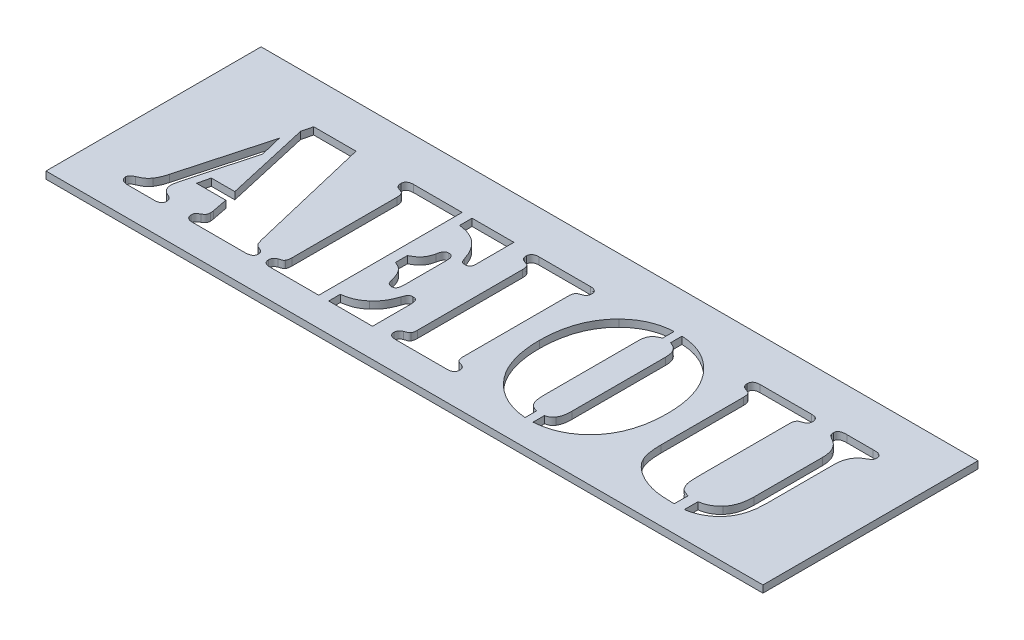
from build123d import *

# Parameters (mm, degrees)
SKETCH1_W           = 50
SKETCH1_H           = 15
BOSS_EXTRUDE1_DEPTH = 0.5
CUT_EXTRUDE1_REACH  = 28.106


with BuildPart() as part:
    # Sketch1 → Boss-Extrude1 (new body)
    with BuildSketch(Plane(origin=(0, 0, 0), x_dir=(1, 0, 0), z_dir=(0, 1, 0))):
        Rectangle(SKETCH1_W, SKETCH1_H)
    extrude(amount=BOSS_EXTRUDE1_DEPTH)

    # Sketch2 → Cut-Extrude1 (cut, up to next)
    with BuildSketch(Plane(origin=(0, 0.5, 0), x_dir=(1, 0, 0), z_dir=(0, 1, 0)), mode=Mode.PRIVATE) as cut_extrude1_sk1:
        with BuildLine():
            Line((-18.337673611, 4.507033689), (-15.386284722, 4.507033689))
            Line((-15.386284722, 4.507033689), (-13.335503472, -4.101907283))
            add(Edge.make_bspline(
                [(-13.335503472, -4.101907283), (-13.31571659, -4.173193323), (-13.277982556, -4.309137424), (-13.227253077, -4.440773778), (-13.203125, -4.503382978)],
                knots=[0, 0, 0, 0, 1.048755183, 2, 2, 2, 2], degree=3))
            add(Edge.make_bspline(
                [(-13.203125, -4.503382978), (-13.189801958, -4.526708407), (-13.162169427, -4.575086298), (-13.09409429, -4.634093988), (-13.009454398, -4.688410957), (-12.943250713, -4.716359995), (-12.907986111, -4.731247561)],
                knots=[0, 0, 0, 0, 0.840160251, 1.742526606, 2.797515595, 4, 4, 4, 4], degree=3))
            add(Edge.make_bspline(
                [(-12.907986111, -4.731247561), (-12.852666047, -4.75584302), (-12.757778354, -4.79803036), (-12.641851728, -4.881220271), (-12.575758787, -4.989270356), (-12.571630909, -5.068863034), (-12.569444444, -5.111021867)],
                knots=[0, 0, 0, 0, 1.326867952, 2.275909135, 3.086779591, 4, 4, 4, 4], degree=3))
            add(Edge.make_bspline(
                [(-12.569444444, -5.111021867), (-12.570763223, -5.140939839), (-12.573307323, -5.198655589), (-12.602706683, -5.278735913), (-12.650267163, -5.347111766), (-12.717303399, -5.401839339), (-12.802967775, -5.442991364), (-12.905532483, -5.472848329), (-13.026827736, -5.489279696), (-13.113376601, -5.491680641), (-13.159722222, -5.492966311)],
                knots=[0, 0, 0, 0, 0.899652897, 1.735550104, 2.535289427, 3.388132219, 4.315971308, 5.386976564, 6.600765056, 8, 8, 8, 8], degree=3))
            Line((-13.159722222, -5.492966311), (-16.814236111, -5.492966311))
            add(Edge.make_bspline(
                [(-16.814236111, -5.492966311), (-16.848382867, -5.492037961), (-16.914538807, -5.490239376), (-17.00724797, -5.467551949), (-17.09105245, -5.435117567), (-17.162233739, -5.387795061), (-17.219559933, -5.328245792), (-17.262338966, -5.259855291), (-17.286573738, -5.181299037), (-17.289931903, -5.126374168), (-17.291666667, -5.098001033)],
                knots=[0, 0, 0, 0, 1.175318829, 2.277063206, 3.273429624, 4.263211015, 5.198644873, 6.106027898, 7.021610334, 8, 8, 8, 8], degree=3))
            add(Edge.make_bspline(
                [(-17.291666667, -5.098001033), (-17.290296603, -5.054174847), (-17.287858408, -4.976180792), (-17.249915704, -4.884635257), (-17.198259915, -4.82860937), (-17.141642569, -4.786075371), (-17.071172085, -4.735594692), (-17.01571023, -4.704618629), (-16.985677083, -4.687844783)],
                knots=[0, 0, 0, 0, 1.432553572, 2.549404146, 3.155101411, 3.915709373, 4.871335893, 6, 6, 6, 6], degree=3))
            add(Edge.make_bspline(
                [(-16.985677083, -4.687844783), (-16.9451778, -4.662997846), (-16.87225783, -4.618260316), (-16.78822521, -4.527889373), (-16.740696936, -4.419393316), (-16.737706092, -4.341127905), (-16.736111111, -4.299389922)],
                knots=[0, 0, 0, 0, 1.161992046, 2.092195629, 2.982591342, 4, 4, 4, 4], degree=3))
            add(Edge.make_bspline(
                [(-16.736111111, -4.299389922), (-16.736415512, -4.259500284), (-16.736988204, -4.184452867), (-16.749691292, -4.110507236), (-16.755642361, -4.075865617)],
                knots=[0, 0, 0, 0, 1.063051602, 2, 2, 2, 2], degree=3))
            Line((-16.755642361, -4.075865617), (-16.968315972, -2.992966311))
            Line((-16.968315972, -2.992966311), (-19.010416667, -2.992966311))
            Line((-19.010416667, -2.992966311), (-18.812934028, -2.159632978))
            Line((-18.812934028, -2.159632978), (-17.172309028, -2.159632978))
            Line((-17.172309028, -2.159632978), (-18.519965278, 3.777867022))
            Line((-18.519965278, 3.777867022), (-18.337673611, 4.507033689))
        make_face()
    cut_extrude1_tool1 = extrude(cut_extrude1_sk1.sketch, amount=-CUT_EXTRUDE1_REACH, mode=Mode.PRIVATE) & part.part
    # Sketch2 → Cut-Extrude1 (cut, up to next)
    with BuildSketch(Plane(origin=(0, 0.5, 0), x_dir=(1, 0, 0), z_dir=(0, 1, 0)), mode=Mode.PRIVATE) as cut_extrude1_sk2:
        with BuildLine():
            Line((-18.843315972, 2.619012856), (-18.470052083, 1.095575356))
            Line((-18.470052083, 1.095575356), (-19.735243056, -3.613626033))
            add(Edge.make_bspline(
                [(-19.735243056, -3.613626033), (-19.75113154, -3.678415772), (-19.781579767, -3.802576928), (-19.78840363, -3.930202275), (-19.791666667, -3.9912302)],
                knots=[0, 0, 0, 0, 1.043639418, 2, 2, 2, 2], degree=3))
            add(Edge.make_bspline(
                [(-19.791666667, -3.9912302), (-19.787963166, -4.062970612), (-19.780891211, -4.19996126), (-19.702393275, -4.386972131), (-19.578817938, -4.544382617), (-19.46462721, -4.611690815), (-19.405381944, -4.646612144)],
                knots=[0, 0, 0, 0, 1.065909191, 2.035388236, 2.980705811, 4, 4, 4, 4], degree=3))
            Line((-19.405381944, -4.646612144), (-19.175347222, -4.763799644))
            add(Edge.make_bspline(
                [(-19.175347222, -4.763799644), (-19.142106966, -4.783717378), (-19.078737399, -4.82168875), (-19.00680033, -4.907779295), (-18.964568383, -5.012653825), (-18.960459118, -5.088926146), (-18.958333333, -5.128382978)],
                knots=[0, 0, 0, 0, 1.03129857, 1.96607825, 2.947821365, 4, 4, 4, 4], degree=3))
            add(Edge.make_bspline(
                [(-18.958333333, -5.128382978), (-18.959020346, -5.156816813), (-18.960335004, -5.211227419), (-18.985850009, -5.286539465), (-19.023169141, -5.351042161), (-19.074519983, -5.406256547), (-19.144270206, -5.443927793), (-19.226280524, -5.472489442), (-19.322985388, -5.489340254), (-19.392295496, -5.491705239), (-19.429253472, -5.492966311)],
                knots=[0, 0, 0, 0, 1.001089615, 1.915671698, 2.776004461, 3.626767041, 4.544209435, 5.547912865, 6.692482548, 8, 8, 8, 8], degree=3))
            Line((-19.429253472, -5.492966311), (-21.2890625, -5.492966311))
            add(Edge.make_bspline(
                [(-21.2890625, -5.492966311), (-21.331854338, -5.492048359), (-21.413714078, -5.49029234), (-21.529085555, -5.468108104), (-21.63155355, -5.433861621), (-21.718141382, -5.38471791), (-21.788376453, -5.322204498), (-21.839322542, -5.248007396), (-21.868381196, -5.161482218), (-21.872739289, -5.101107781), (-21.875, -5.069789228)],
                knots=[0, 0, 0, 0, 1.263225168, 2.41651886, 3.457937625, 4.444571192, 5.337806274, 6.215550556, 7.074337118, 8, 8, 8, 8], degree=3))
            add(Edge.make_bspline(
                [(-21.875, -5.069789228), (-21.871241677, -5.034860509), (-21.863453385, -4.962478467), (-21.794191419, -4.865733653), (-21.689498084, -4.781855681), (-21.602045649, -4.740843279), (-21.553819444, -4.718226728)],
                knots=[0, 0, 0, 0, 0.824400861, 1.708388363, 2.736276122, 4, 4, 4, 4], degree=3))
            add(Edge.make_bspline(
                [(-21.553819444, -4.718226728), (-21.506631177, -4.697629331), (-21.4179337, -4.658913412), (-21.296373128, -4.599119387), (-21.196233501, -4.540066501), (-21.084561047, -4.466021097), (-20.960504741, -4.354339601), (-20.878678201, -4.248760553), (-20.835503472, -4.193053117)],
                knots=[0, 0, 0, 0, 1.026075952, 1.928664772, 2.697596979, 3.341335493, 4.597189607, 6, 6, 6, 6], degree=3))
            add(Edge.make_bspline(
                [(-20.835503472, -4.193053117), (-20.801818581, -4.139426182), (-20.731441334, -4.027384375), (-20.644343492, -3.838823248), (-20.562546251, -3.627682914), (-20.520894771, -3.475912121), (-20.499131944, -3.396612144)],
                knots=[0, 0, 0, 0, 0.874304226, 1.826668352, 2.864437965, 4, 4, 4, 4], degree=3))
            Line((-20.499131944, -3.396612144), (-18.843315972, 2.619012856))
        make_face()
    cut_extrude1_tool2 = extrude(cut_extrude1_sk2.sketch, amount=-CUT_EXTRUDE1_REACH, mode=Mode.PRIVATE) & part.part
    # Sketch2 → Cut-Extrude1 (cut, up to next)
    with BuildSketch(Plane(origin=(0, 0.5, 0), x_dir=(1, 0, 0), z_dir=(0, 1, 0)), mode=Mode.PRIVATE) as cut_extrude1_sk3:
        with BuildLine():
            Line((-7.986111111, 4.507033689), (-7.986111111, -5.492966311))
            Line((-7.986111111, -5.492966311), (-11.187065972, -5.492966311))
            Line((-11.187065972, -5.492966311), (-11.378038194, -5.492966311))
            add(Edge.make_bspline(
                [(-11.378038194, -5.492966311), (-11.415734546, -5.491718984), (-11.486509234, -5.489377135), (-11.586733015, -5.472032688), (-11.674261968, -5.442864847), (-11.747034819, -5.39861559), (-11.806665932, -5.343796693), (-11.844521933, -5.274744009), (-11.87067092, -5.197499905), (-11.873501501, -5.142374945), (-11.875, -5.113192006)],
                knots=[0, 0, 0, 0, 1.275809178, 2.395324508, 3.433364274, 4.378530456, 5.262016052, 6.140052186, 7.015350866, 8, 8, 8, 8], degree=3))
            add(Edge.make_bspline(
                [(-11.875, -5.113192006), (-11.872047558, -5.067075163), (-11.866494123, -4.980331052), (-11.814398118, -4.861973807), (-11.723355218, -4.771569958), (-11.645072128, -4.7380814), (-11.603732639, -4.720396867)],
                knots=[0, 0, 0, 0, 1.074896783, 2.021841926, 2.955380476, 4, 4, 4, 4], degree=3))
            add(Edge.make_bspline(
                [(-11.603732639, -4.720396867), (-11.569685212, -4.708241351), (-11.510203504, -4.687005361), (-11.433201524, -4.657612075), (-11.379181117, -4.638852896), (-11.33541294, -4.62199473), (-11.295582717, -4.590150305), (-11.274903721, -4.557098147), (-11.263020833, -4.5381052)],
                knots=[0, 0, 0, 0, 1.641128884, 2.867093284, 3.73955991, 4.239698614, 4.988468111, 6, 6, 6, 6], degree=3))
            add(Edge.make_bspline(
                [(-11.263020833, -4.5381052), (-11.249721562, -4.516134601), (-11.221073296, -4.468807227), (-11.197388785, -4.382380337), (-11.181799641, -4.280462451), (-11.180992777, -4.206882707), (-11.180555556, -4.16701145)],
                knots=[0, 0, 0, 0, 0.795728394, 1.714096871, 2.761318972, 4, 4, 4, 4], degree=3))
            Line((-11.180555556, -4.16701145), (-11.180555556, 3.155037161))
            add(Edge.make_bspline(
                [(-11.180555556, 3.155037161), (-11.181085636, 3.195612043), (-11.182074586, 3.271310878), (-11.196757568, 3.37560309), (-11.221597027, 3.463786992), (-11.249769855, 3.512091591), (-11.263020833, 3.534811467)],
                knots=[0, 0, 0, 0, 1.234380862, 2.302932019, 3.201790819, 4, 4, 4, 4], degree=3))
            add(Edge.make_bspline(
                [(-11.263020833, 3.534811467), (-11.27491005, 3.553787726), (-11.295600059, 3.586810843), (-11.335370591, 3.618812666), (-11.379555471, 3.635299177), (-11.432563262, 3.657444964), (-11.510360933, 3.685467304), (-11.569742521, 3.70696688), (-11.603732639, 3.719273272)],
                knots=[0, 0, 0, 0, 1.009569614, 1.75688657, 2.256055053, 3.138468602, 4.362054748, 6, 6, 6, 6], degree=3))
            add(Edge.make_bspline(
                [(-11.603732639, 3.719273272), (-11.645307941, 3.736725906), (-11.725002164, 3.770180241), (-11.813794063, 3.865445165), (-11.866611021, 3.985651947), (-11.872088746, 4.073865817), (-11.875, 4.120748967)],
                knots=[0, 0, 0, 0, 1.03007389, 1.974512116, 2.923511095, 4, 4, 4, 4], degree=3))
            add(Edge.make_bspline(
                [(-11.875, 4.120748967), (-11.873466435, 4.150633704), (-11.87056708, 4.207133722), (-11.845038305, 4.286097394), (-11.806604348, 4.355639572), (-11.74710385, 4.410669351), (-11.673812929, 4.454249548), (-11.587250182, 4.486806964), (-11.486427418, 4.503220442), (-11.415706114, 4.505708492), (-11.378038194, 4.507033689)],
                knots=[0, 0, 0, 0, 1.002003185, 1.894384998, 2.766311233, 3.643649008, 4.582238159, 5.621343591, 6.733068665, 8, 8, 8, 8], degree=3))
            Line((-11.378038194, 4.507033689), (-11.187065972, 4.507033689))
            Line((-11.187065972, 4.507033689), (-7.986111111, 4.507033689))
        make_face()
    cut_extrude1_tool3 = extrude(cut_extrude1_sk3.sketch, amount=-CUT_EXTRUDE1_REACH, mode=Mode.PRIVATE) & part.part
    # Sketch2 → Cut-Extrude1 (cut, up to next)
    with BuildSketch(Plane(origin=(0, 0.5, 0), x_dir=(1, 0, 0), z_dir=(0, 1, 0)), mode=Mode.PRIVATE) as cut_extrude1_sk4:
        with BuildLine():
            Line((-7.291666667, 4.507033689), (-4.375, 4.507033689))
            Line((-4.375, 4.507033689), (-4.375, 1.874655217))
            add(Edge.make_bspline(
                [(-4.375, 1.874655217), (-4.375142515, 1.83979283), (-4.375406039, 1.775328797), (-4.394584754, 1.686721636), (-4.418381545, 1.610801577), (-4.458588591, 1.550396857), (-4.510969484, 1.50434005), (-4.576059238, 1.474974141), (-4.652224237, 1.4540813), (-4.707580347, 1.452389752), (-4.737413194, 1.451478133)],
                knots=[0, 0, 0, 0, 1.297100046, 2.398467488, 3.37194797, 4.248080405, 5.071011418, 5.940462097, 6.890061477, 8, 8, 8, 8], degree=3))
            add(Edge.make_bspline(
                [(-4.737413194, 1.451478133), (-4.783166633, 1.454292744), (-4.864361998, 1.459287633), (-4.961916961, 1.499883234), (-5.007499181, 1.563147057), (-5.043170528, 1.622892329), (-5.076658193, 1.700436418), (-5.095977961, 1.758752155), (-5.106336806, 1.7900198)],
                knots=[0, 0, 0, 0, 1.496408907, 2.655570162, 3.259085196, 3.998612629, 4.926899124, 6, 6, 6, 6], degree=3))
            add(Edge.make_bspline(
                [(-5.106336806, 1.7900198), (-5.154432703, 1.925909722), (-5.246724198, 2.186669677), (-5.432796711, 2.543225001), (-5.65238284, 2.848016138), (-5.906870473, 3.103657718), (-6.196968911, 3.310815802), (-6.527236633, 3.467510134), (-6.894786798, 3.582305839), (-7.156334657, 3.618223312), (-7.291666667, 3.636807994)],
                knots=[0, 0, 0, 0, 1.130832012, 2.169960077, 3.145894403, 4.069657363, 4.990096479, 5.930045021, 6.928948727, 8, 8, 8, 8], degree=3))
            Line((-7.291666667, 3.636807994), (-7.291666667, 4.507033689))
        make_face()
    cut_extrude1_tool4 = extrude(cut_extrude1_sk4.sketch, amount=-CUT_EXTRUDE1_REACH, mode=Mode.PRIVATE) & part.part
    # Sketch2 → Cut-Extrude1 (cut, up to next)
    with BuildSketch(Plane(origin=(0, 0.5, 0), x_dir=(1, 0, 0), z_dir=(0, 1, 0)), mode=Mode.PRIVATE) as cut_extrude1_sk5:
        with BuildLine():
            Line((-7.291666667, -0.851039228), (-7.291666667, -0.0068552))
            add(Edge.make_bspline(
                [(-7.291666667, -0.0068552), (-7.227635008, 0.027877684), (-7.105237776, 0.09426998), (-6.93635889, 0.200205559), (-6.798654485, 0.317803711), (-6.6809029, 0.438287035), (-6.588038715, 0.577000689), (-6.507511755, 0.730780446), (-6.442633332, 0.906126489), (-6.411537258, 1.030848356), (-6.395399306, 1.095575356)],
                knots=[0, 0, 0, 0, 1.180986571, 2.257469038, 3.222785507, 4.110265038, 4.978639913, 5.917385587, 6.919184056, 8, 8, 8, 8], degree=3))
            add(Edge.make_bspline(
                [(-6.395399306, 1.095575356), (-6.386107869, 1.139198457), (-6.369042952, 1.219317889), (-6.333625507, 1.327400225), (-6.296665359, 1.414657552), (-6.25135665, 1.482349561), (-6.197411524, 1.531479427), (-6.135554325, 1.567477738), (-6.063077838, 1.587136658), (-6.012124521, 1.589251365), (-5.985243056, 1.590367022)],
                knots=[0, 0, 0, 0, 1.505392146, 2.764846178, 3.836585285, 4.697326174, 5.492824879, 6.280783141, 7.092991927, 8, 8, 8, 8], degree=3))
            add(Edge.make_bspline(
                [(-5.985243056, 1.590367022), (-5.950095918, 1.588982531), (-5.883295321, 1.58635117), (-5.793223499, 1.547505383), (-5.720724744, 1.485314004), (-5.690630735, 1.430298507), (-5.674913194, 1.401564939)],
                knots=[0, 0, 0, 0, 1.085852217, 2.06376913, 2.988742716, 4, 4, 4, 4], degree=3))
            add(Edge.make_bspline(
                [(-5.674913194, 1.401564939), (-5.666934147, 1.380052299), (-5.647713417, 1.328230494), (-5.636692181, 1.23100867), (-5.624172412, 1.10460153), (-5.624704157, 1.009562515), (-5.625, 0.956686467)],
                knots=[0, 0, 0, 0, 0.609895254, 1.469176849, 2.591947466, 4, 4, 4, 4], degree=3))
            Line((-5.625, 0.956686467), (-5.625, -1.818921172))
            add(Edge.make_bspline(
                [(-5.625, -1.818921172), (-5.625764447, -1.872464188), (-5.627172135, -1.971060691), (-5.638656283, -2.106505705), (-5.66162695, -2.215257957), (-5.693106585, -2.30113506), (-5.741154251, -2.36363081), (-5.803875932, -2.407240963), (-5.882023898, -2.433398926), (-5.9394547, -2.436016299), (-5.970052083, -2.437410756)],
                knots=[0, 0, 0, 0, 1.58411055, 2.917051989, 4.012593196, 4.866950163, 5.598911493, 6.305405458, 7.097171608, 8, 8, 8, 8], degree=3))
            add(Edge.make_bspline(
                [(-5.970052083, -2.437410756), (-6.019746209, -2.43310677), (-6.114599549, -2.424891564), (-6.217602219, -2.353995936), (-6.27336733, -2.271946988), (-6.311582169, -2.193368166), (-6.347006429, -2.098291899), (-6.364338969, -2.028206003), (-6.373697917, -1.990362144)],
                knots=[0, 0, 0, 0, 1.342036637, 2.56160375, 3.240040044, 4.033620071, 4.938225671, 6, 6, 6, 6], degree=3))
            add(Edge.make_bspline(
                [(-6.373697917, -1.990362144), (-6.393675917, -1.910256924), (-6.431844618, -1.757212968), (-6.513243125, -1.547151143), (-6.602507344, -1.363566939), (-6.710724579, -1.211479897), (-6.832272929, -1.085052144), (-6.968287431, -0.981000856), (-7.122866093, -0.901446968), (-7.234588839, -0.868083982), (-7.291666667, -0.851039228)],
                knots=[0, 0, 0, 0, 1.278531199, 2.442680666, 3.485773606, 4.434753066, 5.322955403, 6.195374153, 7.078038041, 8, 8, 8, 8], degree=3))
        make_face()
    cut_extrude1_tool5 = extrude(cut_extrude1_sk5.sketch, amount=-CUT_EXTRUDE1_REACH, mode=Mode.PRIVATE) & part.part
    # Sketch2 → Cut-Extrude1 (cut, up to next)
    with BuildSketch(Plane(origin=(0, 0.5, 0), x_dir=(1, 0, 0), z_dir=(0, 1, 0)), mode=Mode.PRIVATE) as cut_extrude1_sk6:
        with BuildLine():
            Line((-7.291666667, -5.492966311), (-7.291666667, -4.685674644))
            add(Edge.make_bspline(
                [(-7.291666667, -4.685674644), (-7.215597208, -4.672576709), (-7.069315869, -4.647389418), (-6.860813059, -4.60086497), (-6.673588692, -4.543465203), (-6.501404602, -4.481341049), (-6.342464288, -4.399566429), (-6.184288901, -4.305913852), (-6.027201681, -4.193554934), (-5.926082643, -4.108398961), (-5.874565972, -4.065014922)],
                knots=[0, 0, 0, 0, 1.178424117, 2.266106011, 3.258322885, 4.167001624, 5.056005255, 5.982165939, 6.971982955, 8, 8, 8, 8], degree=3))
            add(Edge.make_bspline(
                [(-5.874565972, -4.065014922), (-5.776817748, -3.973793712), (-5.590195801, -3.799633209), (-5.398821034, -3.544867268), (-5.272841712, -3.327661352), (-5.184249868, -3.14260185), (-5.095131538, -2.936068105), (-5.042528294, -2.787866818), (-5.015190972, -2.710848256)],
                knots=[0, 0, 0, 0, 1.478913818, 2.823557948, 3.509390326, 4.258413643, 5.094916917, 6, 6, 6, 6], degree=3))
            add(Edge.make_bspline(
                [(-5.015190972, -2.710848256), (-5.001897739, -2.673790969), (-4.977345045, -2.605345907), (-4.936980055, -2.512962537), (-4.893755081, -2.440827729), (-4.836190652, -2.368517059), (-4.737773384, -2.308471768), (-4.649373675, -2.301952042), (-4.602864583, -2.298521867)],
                knots=[0, 0, 0, 0, 1.119865357, 2.068399023, 2.86239926, 3.505232302, 4.687446157, 6, 6, 6, 6], degree=3))
            add(Edge.make_bspline(
                [(-4.602864583, -2.298521867), (-4.570959118, -2.30041317), (-4.511375565, -2.303945186), (-4.42827902, -2.323761959), (-4.362288052, -2.364835693), (-4.311228512, -2.42268634), (-4.277661776, -2.500918236), (-4.251664888, -2.597937028), (-4.237728146, -2.717702161), (-4.236677979, -2.80486029), (-4.236111111, -2.851907283)],
                knots=[0, 0, 0, 0, 0.999578033, 1.866714988, 2.638932701, 3.392362113, 4.242509345, 5.27434009, 6.528718957, 8, 8, 8, 8], degree=3))
            Line((-4.236111111, -2.851907283), (-4.236111111, -5.492966311))
            Line((-4.236111111, -5.492966311), (-7.291666667, -5.492966311))
        make_face()
    cut_extrude1_tool6 = extrude(cut_extrude1_sk6.sketch, amount=-CUT_EXTRUDE1_REACH, mode=Mode.PRIVATE) & part.part
    # Sketch2 → Cut-Extrude1 (cut, up to next)
    with BuildSketch(Plane(origin=(0, 0.5, 0), x_dir=(1, 0, 0), z_dir=(0, 1, 0)), mode=Mode.PRIVATE) as cut_extrude1_sk7:
        with BuildLine():
            Line((0.770399306, -5.492966311), (-2.437065972, -5.492966311))
            Line((-2.437065972, -5.492966311), (-2.628038194, -5.492966311))
            add(Edge.make_bspline(
                [(-2.628038194, -5.492966311), (-2.665734546, -5.491718984), (-2.736509234, -5.489377135), (-2.836733015, -5.472032688), (-2.924261968, -5.442864847), (-2.997034819, -5.39861559), (-3.056665932, -5.343796693), (-3.094521933, -5.274744009), (-3.12067092, -5.197499905), (-3.123501501, -5.142374945), (-3.125, -5.113192006)],
                knots=[0, 0, 0, 0, 1.275809178, 2.395324508, 3.433364274, 4.378530456, 5.262016052, 6.140052186, 7.015350866, 8, 8, 8, 8], degree=3))
            add(Edge.make_bspline(
                [(-3.125, -5.113192006), (-3.122047558, -5.067075163), (-3.116494123, -4.980331052), (-3.064398118, -4.861973807), (-2.973355218, -4.771569958), (-2.895072128, -4.7380814), (-2.853732639, -4.720396867)],
                knots=[0, 0, 0, 0, 1.074896783, 2.021841926, 2.955380476, 4, 4, 4, 4], degree=3))
            add(Edge.make_bspline(
                [(-2.853732639, -4.720396867), (-2.819685212, -4.708241351), (-2.760203504, -4.687005361), (-2.683201524, -4.657612075), (-2.629181117, -4.638852896), (-2.58541294, -4.62199473), (-2.545582717, -4.590150305), (-2.524903721, -4.557098147), (-2.513020833, -4.5381052)],
                knots=[0, 0, 0, 0, 1.641128884, 2.867093284, 3.73955991, 4.239698614, 4.988468111, 6, 6, 6, 6], degree=3))
            add(Edge.make_bspline(
                [(-2.513020833, -4.5381052), (-2.499721562, -4.516134601), (-2.471073296, -4.468807227), (-2.447388785, -4.382380337), (-2.431799641, -4.280462451), (-2.430992777, -4.206882707), (-2.430555556, -4.16701145)],
                knots=[0, 0, 0, 0, 0.795728394, 1.714096871, 2.761318972, 4, 4, 4, 4], degree=3))
            Line((-2.430555556, -4.16701145), (-2.430555556, 3.155037161))
            add(Edge.make_bspline(
                [(-2.430555556, 3.155037161), (-2.431085636, 3.195612043), (-2.432074586, 3.271310878), (-2.446757568, 3.37560309), (-2.471597027, 3.463786992), (-2.499769855, 3.512091591), (-2.513020833, 3.534811467)],
                knots=[0, 0, 0, 0, 1.234380862, 2.302932019, 3.201790819, 4, 4, 4, 4], degree=3))
            add(Edge.make_bspline(
                [(-2.513020833, 3.534811467), (-2.52491005, 3.553787726), (-2.545600059, 3.586810843), (-2.585370591, 3.618812666), (-2.629555471, 3.635299177), (-2.682563262, 3.657444964), (-2.760360933, 3.685467304), (-2.819742521, 3.70696688), (-2.853732639, 3.719273272)],
                knots=[0, 0, 0, 0, 1.009569614, 1.75688657, 2.256055053, 3.138468602, 4.362054748, 6, 6, 6, 6], degree=3))
            add(Edge.make_bspline(
                [(-2.853732639, 3.719273272), (-2.895307941, 3.736725906), (-2.975002164, 3.770180241), (-3.063794063, 3.865445165), (-3.116611021, 3.985651947), (-3.122088746, 4.073865817), (-3.125, 4.120748967)],
                knots=[0, 0, 0, 0, 1.03007389, 1.974512116, 2.923511095, 4, 4, 4, 4], degree=3))
            add(Edge.make_bspline(
                [(-3.125, 4.120748967), (-3.123466435, 4.150633704), (-3.12056708, 4.207133722), (-3.095038305, 4.286097394), (-3.056604348, 4.355639572), (-2.99710385, 4.410669351), (-2.923812929, 4.454249548), (-2.837250182, 4.486806964), (-2.736427418, 4.503220442), (-2.665706114, 4.505708492), (-2.628038194, 4.507033689)],
                knots=[0, 0, 0, 0, 1.002003185, 1.894384998, 2.766311233, 3.643649008, 4.582238159, 5.621343591, 6.733068665, 8, 8, 8, 8], degree=3))
            Line((-2.628038194, 4.507033689), (-2.437065972, 4.507033689))
            Line((-2.437065972, 4.507033689), (0.770399306, 4.507033689))
            Line((0.770399306, 4.507033689), (0.961371528, 4.507033689))
            add(Edge.make_bspline(
                [(0.961371528, 4.507033689), (0.99902501, 4.505672993), (1.06971921, 4.503118293), (1.170050395, 4.487254698), (1.255432353, 4.453668014), (1.328459968, 4.410823357), (1.387429437, 4.355004749), (1.428825272, 4.286797017), (1.453737105, 4.207034976), (1.456743272, 4.150599543), (1.458333333, 4.120748967)],
                knots=[0, 0, 0, 0, 1.268560657, 2.381715452, 3.39938894, 4.339185152, 5.217651218, 6.10317875, 6.996708201, 8, 8, 8, 8], degree=3))
            add(Edge.make_bspline(
                [(1.458333333, 4.120748967), (1.455422079, 4.073865817), (1.449944354, 3.985651947), (1.397127397, 3.865445165), (1.308335498, 3.770180241), (1.228641275, 3.736725906), (1.187065972, 3.719273272)],
                knots=[0, 0, 0, 0, 1.076488905, 2.025487884, 2.96992611, 4, 4, 4, 4], degree=3))
            add(Edge.make_bspline(
                [(1.187065972, 3.719273272), (1.153059126, 3.707016915), (1.093648312, 3.685604751), (1.015380162, 3.656865066), (0.961389584, 3.635553293), (0.916872884, 3.619239442), (0.879006507, 3.585857494), (0.858381309, 3.553613728), (0.846354167, 3.534811467)],
                knots=[0, 0, 0, 0, 1.636602956, 2.859186374, 3.771360974, 4.270120389, 4.991257728, 6, 6, 6, 6], degree=3))
            add(Edge.make_bspline(
                [(0.846354167, 3.534811467), (0.832873596, 3.512154179), (0.804317845, 3.464159485), (0.783681901, 3.374940476), (0.76427582, 3.271638055), (0.764023783, 3.195687136), (0.763888889, 3.155037161)],
                knots=[0, 0, 0, 0, 0.798774196, 1.692034923, 2.764745377, 4, 4, 4, 4], degree=3))
            Line((0.763888889, 3.155037161), (0.763888889, -4.16701145))
            add(Edge.make_bspline(
                [(0.763888889, -4.16701145), (0.763925248, -4.206960488), (0.763992452, -4.28080057), (0.784300197, -4.381715539), (0.80380566, -4.4691761), (0.832830063, -4.516195986), (0.846354167, -4.5381052)],
                knots=[0, 0, 0, 0, 1.239531227, 2.291096129, 3.203725438, 4, 4, 4, 4], degree=3))
            add(Edge.make_bspline(
                [(0.846354167, -4.5381052), (0.858375481, -4.556923467), (0.878990683, -4.58919468), (0.916910432, -4.622430069), (0.961030017, -4.639104185), (1.015986245, -4.65705328), (1.093501913, -4.687129197), (1.153005832, -4.708286431), (1.187065972, -4.720396867)],
                knots=[0, 0, 0, 0, 1.010634903, 1.733125261, 2.232820463, 3.135449138, 4.360326402, 6, 6, 6, 6], degree=3))
            add(Edge.make_bspline(
                [(1.187065972, -4.720396867), (1.228405461, -4.7380814), (1.306688551, -4.771569958), (1.397731452, -4.861973807), (1.449827456, -4.980331052), (1.455380892, -5.067075163), (1.458333333, -5.113192006)],
                knots=[0, 0, 0, 0, 1.044619524, 1.978158074, 2.925103217, 4, 4, 4, 4], degree=3))
            add(Edge.make_bspline(
                [(1.458333333, -5.113192006), (1.45678028, -5.142342004), (1.453846647, -5.197404741), (1.428288993, -5.275432372), (1.387490285, -5.343162373), (1.328388782, -5.39876629), (1.255895927, -5.442290542), (1.169516431, -5.472470036), (1.069805026, -5.489280045), (0.999054833, -5.491685243), (0.961371528, -5.492966311)],
                knots=[0, 0, 0, 0, 0.985947552, 1.862400454, 2.754162249, 3.638812863, 4.585225398, 5.601516872, 6.722508463, 8, 8, 8, 8], degree=3))
            Line((0.961371528, -5.492966311), (0.770399306, -5.492966311))
        make_face()
    cut_extrude1_tool7 = extrude(cut_extrude1_sk7.sketch, amount=-CUT_EXTRUDE1_REACH, mode=Mode.PRIVATE) & part.part
    # Sketch2 → Cut-Extrude1 (cut, up to next)
    with BuildSketch(Plane(origin=(0, 0.5, 0), x_dir=(1, 0, 0), z_dir=(0, 1, 0)), mode=Mode.PRIVATE) as cut_extrude1_sk8:
        with BuildLine():
            add(Edge.make_bspline(
                [(6.597222222, 3.905905217), (6.537967892, 3.882791211), (6.425837781, 3.839051353), (6.275413432, 3.753624415), (6.152548713, 3.656030221), (6.053519568, 3.544410772), (5.985481519, 3.408710809), (5.935601491, 3.251481711), (5.909252157, 3.066186614), (5.905029636, 2.934478257), (5.902777778, 2.86423855)],
                knots=[0, 0, 0, 0, 1.118377415, 2.116364868, 3.030964595, 3.870538326, 4.719041391, 5.681309848, 6.763448884, 8, 8, 8, 8], degree=3))
            Line((5.902777778, 2.86423855), (5.902777778, -3.670049644))
            add(Edge.make_bspline(
                [(5.902777778, -3.670049644), (5.904128244, -3.769350753), (5.906622472, -3.952753709), (5.942204985, -4.20399337), (5.991756127, -4.41230182), (6.054639288, -4.524551828), (6.082899306, -4.574997561)],
                knots=[0, 0, 0, 0, 1.27427824, 2.353512468, 3.260059993, 4, 4, 4, 4], degree=3))
            add(Edge.make_bspline(
                [(6.082899306, -4.574997561), (6.109679505, -4.609669956), (6.165945458, -4.682517631), (6.284716053, -4.768326802), (6.430915076, -4.837678285), (6.539515281, -4.870210763), (6.597222222, -4.887497561)],
                knots=[0, 0, 0, 0, 0.851726799, 1.789501929, 2.825406619, 4, 4, 4, 4], degree=3))
            Line((6.597222222, -4.887497561), (6.597222222, -5.688278811))
            add(Edge.make_bspline(
                [(6.597222222, -5.688278811), (6.463794356, -5.674648809), (6.200313105, -5.647733518), (5.815584739, -5.568261499), (5.447107845, -5.460355318), (5.096342049, -5.319868406), (4.760540671, -5.153338218), (4.442700684, -4.954430224), (4.140660498, -4.726093511), (3.9560796, -4.552169852), (3.862847222, -4.464320478)],
                knots=[0, 0, 0, 0, 1.051385509, 2.076180753, 3.076110661, 4.059092477, 5.035964268, 6.012044883, 6.995877765, 8, 8, 8, 8], degree=3))
            add(Edge.make_bspline(
                [(3.862847222, -4.464320478), (3.747746555, -4.342428363), (3.518281865, -4.099424243), (3.226312282, -3.688257115), (2.980683394, -3.24276188), (2.777842708, -2.762907031), (2.622119463, -2.246855526), (2.510318279, -1.697006699), (2.441597866, -1.111752557), (2.434303745, -0.710173952), (2.430555556, -0.503817006)],
                knots=[0, 0, 0, 0, 0.929101366, 1.852256478, 2.788058139, 3.746505495, 4.736611211, 5.773063896, 6.855656831, 8, 8, 8, 8], degree=3))
            add(Edge.make_bspline(
                [(2.430555556, -0.503817006), (2.434881391, -0.295983082), (2.443348957, 0.110839524), (2.517098555, 0.70462232), (2.632848285, 1.267976644), (2.797497847, 1.79903176), (3.009535067, 2.295873918), (3.270672192, 2.75347614), (3.569891943, 3.178727082), (3.810177465, 3.424932957), (3.930121528, 3.5478323)],
                knots=[0, 0, 0, 0, 1.123125173, 2.198451065, 3.229210727, 4.228575418, 5.199030772, 6.142910105, 7.072990733, 8, 8, 8, 8], degree=3))
            add(Edge.make_bspline(
                [(3.930121528, 3.5478323), (4.024866737, 3.635619454), (4.211349561, 3.808407043), (4.512125249, 4.034501006), (4.823979769, 4.226705588), (5.148047336, 4.386488137), (5.485592463, 4.515607742), (5.840555395, 4.610751473), (6.212394476, 4.677014013), (6.467477853, 4.695243944), (6.597222222, 4.704516328)],
                knots=[0, 0, 0, 0, 1.041191674, 2.049331728, 3.02892685, 3.991699427, 4.959285675, 5.938654922, 6.951527461, 8, 8, 8, 8], degree=3))
            Line((6.597222222, 4.704516328), (6.597222222, 3.905905217))
        make_face()
    cut_extrude1_tool8 = extrude(cut_extrude1_sk8.sketch, amount=-CUT_EXTRUDE1_REACH, mode=Mode.PRIVATE) & part.part
    # Sketch2 → Cut-Extrude1 (cut, up to next)
    with BuildSketch(Plane(origin=(0, 0.5, 0), x_dir=(1, 0, 0), z_dir=(0, 1, 0)), mode=Mode.PRIVATE) as cut_extrude1_sk9:
        with BuildLine():
            Line((7.152777778, 3.905905217), (7.152777778, 4.704516328))
            add(Edge.make_bspline(
                [(7.152777778, 4.704516328), (7.282537425, 4.69531796), (7.536939728, 4.677283956), (7.90856088, 4.610085805), (8.263850278, 4.516151728), (8.602383704, 4.385869926), (8.927788332, 4.227362973), (9.240003049, 4.034413563), (9.540831568, 3.808430012), (9.727307104, 3.635627192), (9.822048611, 3.5478323)],
                knots=[0, 0, 0, 0, 1.04780179, 2.054284169, 3.038654616, 4.005621862, 4.973010873, 5.95197931, 6.959474417, 8, 8, 8, 8], degree=3))
            add(Edge.make_bspline(
                [(9.822048611, 3.5478323), (9.942464742, 3.423301438), (10.182905994, 3.174644083), (10.486144654, 2.751005977), (10.742988312, 2.293926889), (10.95776375, 1.804100017), (11.119301498, 1.276427878), (11.236076087, 0.714985049), (11.306089203, 0.117162199), (11.314913102, -0.293123013), (11.319444444, -0.503817006)],
                knots=[0, 0, 0, 0, 0.935258746, 1.86748057, 2.805880446, 3.76541513, 4.752258028, 5.782852375, 6.861426953, 8, 8, 8, 8], degree=3))
            add(Edge.make_bspline(
                [(11.319444444, -0.503817006), (11.315702667, -0.710176801), (11.308421023, -1.111760952), (11.239612149, -1.696975776), (11.128124814, -2.246964104), (10.971382664, -2.762257772), (10.772465514, -3.243931196), (10.52319996, -3.687636127), (10.231886116, -4.098854896), (10.003644941, -4.342355347), (9.889322917, -4.464320478)],
                knots=[0, 0, 0, 0, 1.144670239, 2.227572595, 3.264321513, 4.254710215, 5.211875763, 6.149896407, 7.07331537, 8, 8, 8, 8], degree=3))
            add(Edge.make_bspline(
                [(9.889322917, -4.464320478), (9.796228688, -4.553061735), (9.612267316, -4.7284213), (9.308722484, -4.956159048), (8.99235887, -5.158140702), (8.655671443, -5.32385139), (8.305494517, -5.465423912), (7.936142573, -5.569562167), (7.55136334, -5.650834443), (7.286976457, -5.67567177), (7.152777778, -5.688278811)],
                knots=[0, 0, 0, 0, 1.006659813, 1.989237384, 2.967081666, 3.942707027, 4.924434617, 5.92149591, 6.944983577, 8, 8, 8, 8], degree=3))
            Line((7.152777778, -5.688278811), (7.152777778, -4.887497561))
            add(Edge.make_bspline(
                [(7.152777778, -4.887497561), (7.210569476, -4.872908309), (7.314536875, -4.84666221), (7.45255882, -4.781491593), (7.561954782, -4.68986517), (7.61799472, -4.614677422), (7.647569444, -4.574997561)],
                knots=[0, 0, 0, 0, 1.186680144, 2.134840347, 3.015673713, 4, 4, 4, 4], degree=3))
            add(Edge.make_bspline(
                [(7.647569444, -4.574997561), (7.678649376, -4.519515093), (7.744946677, -4.401164189), (7.804590715, -4.189787872), (7.84057749, -3.94260829), (7.844908104, -3.76497188), (7.847222222, -3.670049644)],
                knots=[0, 0, 0, 0, 0.810910452, 1.729771362, 2.786874963, 4, 4, 4, 4], degree=3))
            Line((7.847222222, -3.670049644), (7.847222222, 2.86423855))
            add(Edge.make_bspline(
                [(7.847222222, 2.86423855), (7.845537328, 2.926540279), (7.842330196, 3.045129265), (7.819040073, 3.212704356), (7.779626904, 3.36144939), (7.735818987, 3.447863474), (7.71484375, 3.48923855)],
                knots=[0, 0, 0, 0, 1.157578965, 2.203407792, 3.139791374, 4, 4, 4, 4], degree=3))
            add(Edge.make_bspline(
                [(7.71484375, 3.48923855), (7.68421467, 3.53701377), (7.625613774, 3.62841941), (7.503879709, 3.743199997), (7.343601618, 3.83268741), (7.221537991, 3.879522392), (7.152777778, 3.905905217)],
                knots=[0, 0, 0, 0, 0.947326719, 1.812466874, 2.767730825, 4, 4, 4, 4], degree=3))
        make_face()
    cut_extrude1_tool9 = extrude(cut_extrude1_sk9.sketch, amount=-CUT_EXTRUDE1_REACH, mode=Mode.PRIVATE) & part.part
    # Sketch2 → Cut-Extrude1 (cut, up to next)
    with BuildSketch(Plane(origin=(0, 0.5, 0), x_dir=(1, 0, 0), z_dir=(0, 1, 0)), mode=Mode.PRIVATE) as cut_extrude1_sk10:
        with BuildLine():
            Line((12.986111111, -2.5849802), (12.986111111, 3.155037161))
            add(Edge.make_bspline(
                [(12.986111111, 3.155037161), (12.98558103, 3.195612043), (12.984592081, 3.271310878), (12.969909098, 3.37560309), (12.94506964, 3.463786992), (12.916896811, 3.512091591), (12.903645833, 3.534811467)],
                knots=[0, 0, 0, 0, 1.234380862, 2.302932019, 3.201790819, 4, 4, 4, 4], degree=3))
            add(Edge.make_bspline(
                [(12.903645833, 3.534811467), (12.891756617, 3.553787726), (12.871066607, 3.586810843), (12.831296076, 3.618812666), (12.787111195, 3.635299177), (12.734103404, 3.657444964), (12.656305734, 3.685467304), (12.596924146, 3.70696688), (12.562934028, 3.719273272)],
                knots=[0, 0, 0, 0, 1.009569614, 1.75688657, 2.256055053, 3.138468602, 4.362054748, 6, 6, 6, 6], degree=3))
            add(Edge.make_bspline(
                [(12.562934028, 3.719273272), (12.521464683, 3.73683416), (12.44245756, 3.770291048), (12.352912605, 3.862956474), (12.300047364, 3.981256266), (12.294575657, 4.068079593), (12.291666667, 4.11423855)],
                knots=[0, 0, 0, 0, 1.041483567, 1.98422766, 2.928330066, 4, 4, 4, 4], degree=3))
            add(Edge.make_bspline(
                [(12.291666667, 4.11423855), (12.293296953, 4.144787622), (12.296381824, 4.202593372), (12.320620677, 4.284113448), (12.363267525, 4.353570298), (12.423144325, 4.410948271), (12.499080931, 4.453552388), (12.58715469, 4.487604848), (12.690466823, 4.502897682), (12.763285507, 4.505606549), (12.801649306, 4.507033689)],
                knots=[0, 0, 0, 0, 1.002726072, 1.897384446, 2.761532256, 3.652394326, 4.589906903, 5.605228772, 6.738338646, 8, 8, 8, 8], degree=3))
            Line((12.801649306, 4.507033689), (12.979600694, 4.507033689))
            Line((12.979600694, 4.507033689), (16.187065972, 4.507033689))
            Line((16.187065972, 4.507033689), (16.378038194, 4.507033689))
            Line((16.378038194, 4.507033689), (16.642795139, 4.476651744))
            add(Edge.make_bspline(
                [(16.642795139, 4.476651744), (16.675443587, 4.461377994), (16.741898, 4.430288979), (16.814276066, 4.342970215), (16.869301492, 4.236484447), (16.873042474, 4.154807243), (16.875, 4.112068411)],
                knots=[0, 0, 0, 0, 0.92965803, 1.892276139, 2.897101623, 4, 4, 4, 4], degree=3))
            add(Edge.make_bspline(
                [(16.875, 4.112068411), (16.872001275, 4.066649182), (16.866318864, 3.980582376), (16.8137544, 3.862957631), (16.724209011, 3.770290723), (16.645201951, 3.736834048), (16.603732639, 3.719273272)],
                knots=[0, 0, 0, 0, 1.059364441, 2.007434175, 2.954139888, 4, 4, 4, 4], degree=3))
            add(Edge.make_bspline(
                [(16.603732639, 3.719273272), (16.569596529, 3.707352089), (16.509714118, 3.686439652), (16.432475525, 3.654305476), (16.37803453, 3.633439427), (16.333546032, 3.61705251), (16.295670442, 3.583694432), (16.27504697, 3.551446196), (16.263020833, 3.532641328)],
                knots=[0, 0, 0, 0, 1.633395197, 2.865342401, 3.775729129, 4.273510971, 4.993234874, 6, 6, 6, 6], degree=3))
            add(Edge.make_bspline(
                [(16.263020833, 3.532641328), (16.249508664, 3.510729821), (16.220509876, 3.463705013), (16.200462011, 3.374881481), (16.180906596, 3.27165672), (16.180677937, 3.195693644), (16.180555556, 3.155037161)],
                knots=[0, 0, 0, 0, 0.783173522, 1.680787416, 2.758725557, 4, 4, 4, 4], degree=3))
            Line((16.180555556, 3.155037161), (16.180555556, -2.971264922))
            add(Edge.make_bspline(
                [(16.180555556, -2.971264922), (16.180748594, -3.06748829), (16.181101344, -3.243322236), (16.188866884, -3.484141628), (16.194678512, -3.677705038), (16.214687682, -3.869658839), (16.253093378, -4.071461907), (16.318038541, -4.212833521), (16.349826389, -4.282028811)],
                knots=[0, 0, 0, 0, 1.297880407, 2.371684116, 3.250791199, 3.908150793, 4.976130288, 6, 6, 6, 6], degree=3))
            add(Edge.make_bspline(
                [(16.349826389, -4.282028811), (16.380774157, -4.335601735), (16.437591873, -4.433957495), (16.537453442, -4.537470602), (16.639107422, -4.593495848), (16.73899452, -4.634645965), (16.863454126, -4.683883787), (16.956507768, -4.71310353), (17.007378472, -4.729077422)],
                knots=[0, 0, 0, 0, 1.349479507, 2.477540353, 3.078975584, 3.871221815, 4.836236359, 6, 6, 6, 6], degree=3))
            Line((17.007378472, -4.729077422), (17.007378472, -5.688278811))
            Line((17.007378472, -5.688278811), (16.846788194, -5.688278811))
            add(Edge.make_bspline(
                [(16.846788194, -5.688278811), (16.696981825, -5.686253044), (16.410782484, -5.682382894), (16.00070407, -5.651796113), (15.629295329, -5.603496074), (15.398215934, -5.547658579), (15.288628472, -5.521178117)],
                knots=[0, 0, 0, 0, 1.143959209, 2.185490323, 3.139484029, 4, 4, 4, 4], degree=3))
            add(Edge.make_bspline(
                [(15.288628472, -5.521178117), (15.16997918, -5.48643723), (14.937289102, -5.418304842), (14.606565488, -5.28116299), (14.295686231, -5.125903328), (14.011914905, -4.944876657), (13.758217888, -4.746994943), (13.541960475, -4.535473207), (13.360473164, -4.314294326), (13.27373329, -4.151228311), (13.231336806, -4.071525339)],
                knots=[0, 0, 0, 0, 1.145447734, 2.24640467, 3.314177613, 4.363509257, 5.361722521, 6.291268218, 7.164810629, 8, 8, 8, 8], degree=3))
            add(Edge.make_bspline(
                [(13.231336806, -4.071525339), (13.211789482, -4.026961897), (13.171095298, -3.934188432), (13.122779271, -3.784181889), (13.078200755, -3.620147764), (13.044523453, -3.440835013), (13.01930131, -3.247300577), (12.999006805, -3.039633765), (12.989120147, -2.817280969), (12.98713254, -2.663835615), (12.986111111, -2.5849802)],
                knots=[0, 0, 0, 0, 0.768921948, 1.600764009, 2.488515818, 3.455265764, 4.482371669, 5.573753861, 6.753154526, 8, 8, 8, 8], degree=3))
        make_face()
    cut_extrude1_tool10 = extrude(cut_extrude1_sk10.sketch, amount=-CUT_EXTRUDE1_REACH, mode=Mode.PRIVATE) & part.part
    # Sketch2 → Cut-Extrude1 (cut, up to next)
    with BuildSketch(Plane(origin=(0, 0.5, 0), x_dir=(1, 0, 0), z_dir=(0, 1, 0)), mode=Mode.PRIVATE) as cut_extrude1_sk11:
        with BuildLine():
            Line((17.708333333, -5.688278811), (17.708333333, -4.735587839))
            add(Edge.make_bspline(
                [(17.708333333, -4.735587839), (17.819444738, -4.715050608), (18.037067886, -4.674826324), (18.341320559, -4.545378775), (18.621342374, -4.3728887), (18.775946426, -4.217444798), (18.854166667, -4.138799644)],
                knots=[0, 0, 0, 0, 1.02613662, 2.009794435, 2.993077124, 4, 4, 4, 4], degree=3))
            add(Edge.make_bspline(
                [(18.854166667, -4.138799644), (18.89580357, -4.089021646), (18.979832185, -3.988563256), (19.086728253, -3.819738711), (19.17482004, -3.634027224), (19.249401024, -3.433870435), (19.304703043, -3.21761836), (19.346360709, -2.987084989), (19.369791543, -2.740265428), (19.373227081, -2.570560413), (19.375, -2.482983672)],
                knots=[0, 0, 0, 0, 0.876697886, 1.769288871, 2.692224349, 3.651442817, 4.652475985, 5.70565652, 6.815997718, 8, 8, 8, 8], degree=3))
            Line((19.375, -2.482983672), (19.375, 2.276130911))
            add(Edge.make_bspline(
                [(19.375, 2.276130911), (19.373511571, 2.358046436), (19.370636436, 2.516279142), (19.331866036, 2.743214196), (19.274598321, 2.951577726), (19.191832427, 3.140666904), (19.083426667, 3.309094163), (18.955448658, 3.461836006), (18.798518808, 3.590431329), (18.681520086, 3.659991892), (18.621961806, 3.695401744)],
                knots=[0, 0, 0, 0, 1.158086529, 2.237026091, 3.248207816, 4.210847961, 5.145307146, 6.074817308, 7.019984419, 8, 8, 8, 8], degree=3))
            add(Edge.make_bspline(
                [(18.621961806, 3.695401744), (18.58774255, 3.714549882), (18.525681035, 3.749277769), (18.442765948, 3.802594084), (18.379083804, 3.850475732), (18.315070954, 3.910388999), (18.271237198, 4.014221767), (18.266511221, 4.102273251), (18.263888889, 4.151130911)],
                knots=[0, 0, 0, 0, 1.137143506, 2.062372392, 2.855431385, 3.448813392, 4.584407656, 6, 6, 6, 6], degree=3))
            add(Edge.make_bspline(
                [(18.263888889, 4.151130911), (18.265413942, 4.180951844), (18.26830876, 4.237557184), (18.293912236, 4.316958482), (18.342285307, 4.379425219), (18.406794032, 4.430046706), (18.492081931, 4.46587082), (18.597546003, 4.490918312), (18.725001966, 4.505600702), (18.817233408, 4.506530237), (18.8671875, 4.507033689)],
                knots=[0, 0, 0, 0, 0.897096013, 1.702844927, 2.465039847, 3.240496688, 4.147058219, 5.22452456, 6.496756074, 8, 8, 8, 8], degree=3))
            Line((18.8671875, 4.507033689), (20.68359375, 4.507033689))
            add(Edge.make_bspline(
                [(20.68359375, 4.507033689), (20.71759045, 4.507167948), (20.77980645, 4.50741365), (20.86379969, 4.505924755), (20.92957306, 4.500838961), (20.993286766, 4.496571861), (21.061215272, 4.479815365), (21.107293946, 4.453230259), (21.130642361, 4.439759383)],
                knots=[0, 0, 0, 0, 1.333773652, 2.440885764, 3.294120428, 3.921014534, 4.946562232, 6, 6, 6, 6], degree=3))
            add(Edge.make_bspline(
                [(21.130642361, 4.439759383), (21.159252657, 4.420824535), (21.213240853, 4.3850941), (21.274876152, 4.311976221), (21.314498939, 4.227874185), (21.317787228, 4.166746686), (21.319444444, 4.135939939)],
                knots=[0, 0, 0, 0, 1.091391213, 2.059476941, 3.022024376, 4, 4, 4, 4], degree=3))
            add(Edge.make_bspline(
                [(21.319444444, 4.135939939), (21.318359477, 4.109748716), (21.316210107, 4.057862689), (21.294092676, 3.983585802), (21.256270388, 3.915894812), (21.220538566, 3.879138226), (21.202256944, 3.8603323)],
                knots=[0, 0, 0, 0, 1.016371757, 2.013479646, 2.983628243, 4, 4, 4, 4], degree=3))
            add(Edge.make_bspline(
                [(21.202256944, 3.8603323), (21.191509786, 3.851513508), (21.161053548, 3.826522041), (21.097880359, 3.784993596), (21.006070551, 3.725158901), (20.933399188, 3.682725362), (20.891927083, 3.658509383)],
                knots=[0, 0, 0, 0, 0.450033346, 1.275343907, 2.445092823, 4, 4, 4, 4], degree=3))
            add(Edge.make_bspline(
                [(20.891927083, 3.658509383), (20.839943167, 3.627046084), (20.73526884, 3.563691877), (20.601530334, 3.434329785), (20.481739948, 3.284967647), (20.384164766, 3.112162223), (20.305285275, 2.921952369), (20.250110651, 2.717663886), (20.213495739, 2.500963471), (20.210080926, 2.35224187), (20.208333333, 2.276130911)],
                knots=[0, 0, 0, 0, 0.899617234, 1.811460858, 2.744067812, 3.735198226, 4.746433817, 5.793921433, 6.870999549, 8, 8, 8, 8], degree=3))
            Line((20.208333333, 2.276130911), (20.208333333, -2.489494089))
            add(Edge.make_bspline(
                [(20.208333333, -2.489494089), (20.206567842, -2.589368228), (20.203121222, -2.784344138), (20.179050233, -3.070697631), (20.138695233, -3.343498312), (20.079740946, -3.602222271), (20.005824425, -3.847644232), (19.91531897, -4.079585413), (19.806655278, -4.298054463), (19.721190929, -4.433875522), (19.678819444, -4.501212839)],
                knots=[0, 0, 0, 0, 1.135464037, 2.216671254, 3.264679816, 4.268276654, 5.230935086, 6.176328675, 7.095860875, 8, 8, 8, 8], degree=3))
            add(Edge.make_bspline(
                [(19.678819444, -4.501212839), (19.609854288, -4.595349152), (19.470619771, -4.785401994), (19.208705274, -5.033122937), (18.908416962, -5.255206985), (18.683095428, -5.372259739), (18.567708333, -5.432202422)],
                knots=[0, 0, 0, 0, 0.953383016, 1.9247955, 2.937288351, 4, 4, 4, 4], degree=3))
            add(Edge.make_bspline(
                [(18.567708333, -5.432202422), (18.505236165, -5.460838359), (18.377422308, -5.519425562), (18.169895478, -5.588041118), (17.946017447, -5.646845727), (17.788873505, -5.674239052), (17.708333333, -5.688278811)],
                knots=[0, 0, 0, 0, 0.915823789, 1.873713905, 2.910225592, 4, 4, 4, 4], degree=3))
        make_face()
    cut_extrude1_tool11 = extrude(cut_extrude1_sk11.sketch, amount=-CUT_EXTRUDE1_REACH, mode=Mode.PRIVATE) & part.part
    add(cut_extrude1_tool1.solids().sort_by_distance((-15.934964, 0.5, 0.750702))[0], mode=Mode.SUBTRACT)
    add(cut_extrude1_tool2.solids().sort_by_distance((-19.837536, 0.5, 2.589434))[0], mode=Mode.SUBTRACT)
    add(cut_extrude1_tool3.solids().sort_by_distance((-9.643945, 0.5, 0.4917))[0], mode=Mode.SUBTRACT)
    add(cut_extrude1_tool4.solids().sort_by_distance((-5.46488, 0.5, -3.429356))[0], mode=Mode.SUBTRACT)
    add(cut_extrude1_tool5.solids().sort_by_distance((-6.242191, 0.5, 0.41604))[0], mode=Mode.SUBTRACT)
    add(cut_extrude1_tool6.solids().sort_by_distance((-5.354481, 0.5, 4.370492))[0], mode=Mode.SUBTRACT)
    add(cut_extrude1_tool7.solids().sort_by_distance((-0.833364, 0.5, 0.490512))[0], mode=Mode.SUBTRACT)
    add(cut_extrude1_tool8.solids().sort_by_distance((4.51651, 0.5, 0.485854))[0], mode=Mode.SUBTRACT)
    add(cut_extrude1_tool9.solids().sort_by_distance((9.233634, 0.5, 0.487523))[0], mode=Mode.SUBTRACT)
    add(cut_extrude1_tool10.solids().sort_by_distance((14.692551, 0.5, 0.304522))[0], mode=Mode.SUBTRACT)
    add(cut_extrude1_tool11.solids().sort_by_distance((19.587909, 0.5, -0.060572))[0], mode=Mode.SUBTRACT)


solid = part.part
